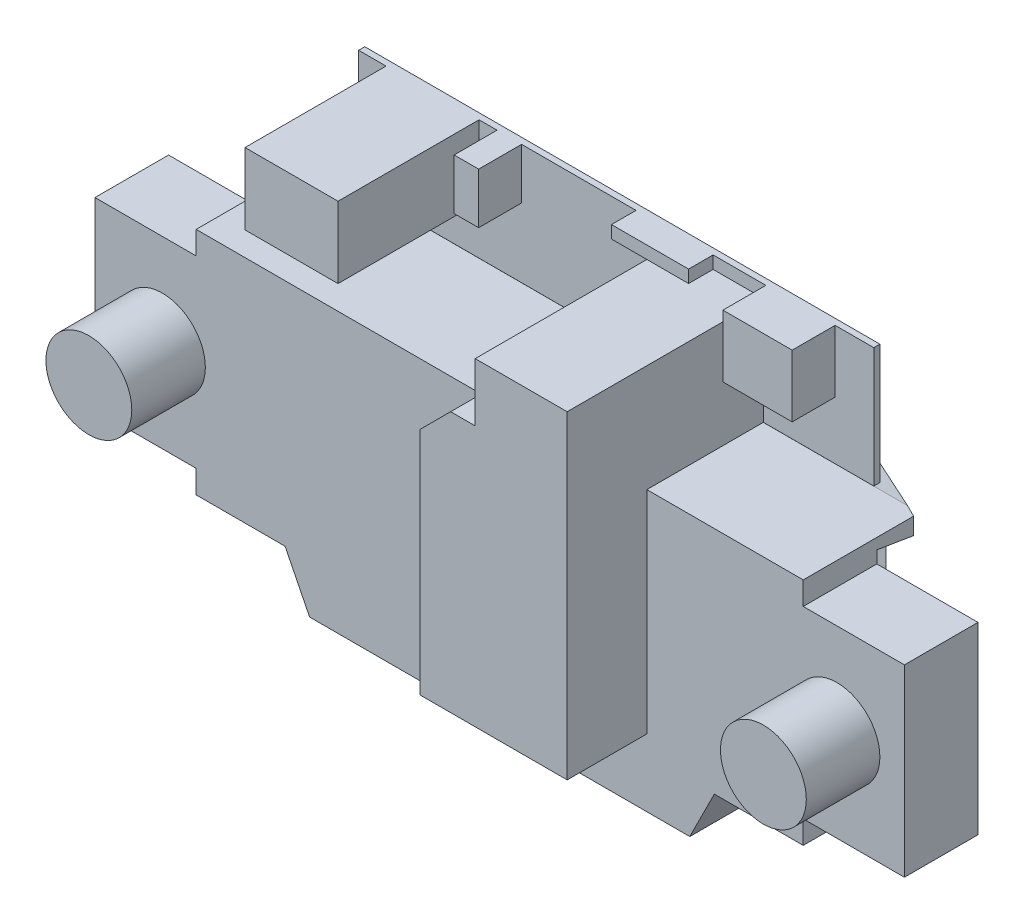
from build123d import *
from OCP.BRepFilletAPI import BRepFilletAPI_MakeChamfer

# Parameters (mm, degrees)
BOSS_EXTRUDE1_DEPTH = 25
SKETCH2_W           = 84
SKETCH2_H           = 19.546511152
BOSS_EXTRUDE2_DEPTH = 24
SKETCH3_W           = 12
SKETCH3_H           = 30
BOSS_EXTRUDE3_DEPTH = 16.5
SKETCH4_W           = 12
SKETCH4_H           = 30
BOSS_EXTRUDE4_DEPTH = 16.5
SKETCH5_W           = 24
SKETCH5_H           = 52
BOSS_EXTRUDE5_DEPTH = 13
SKETCH9_W           = 70
SKETCH9_H           = 10
BOSS_EXTRUDE6_DEPTH = 8
CHAMFER1_SIZE       = 8
CHAMFER1_SIZE_2     = 4
SKETCH10_R          = 7
BOSS_EXTRUDE7_DEPTH = 12
SKETCH11_R          = 1
CUT_EXTRUDE1_DEPTH  = 5
CUT_EXTRUDE24_DEPTH = 37.4999
CUT_EXTRUDE25_REACH = 90.714
CUT_EXTRUDE26_DEPTH = 99
CUT_EXTRUDE27_REACH = 129.479
CUT_EXTRUDE28_DEPTH = 69.00303493
CUT_EXTRUDE29_REACH = 129.479
SKETCH19_W          = 69.00303493
SKETCH19_H          = 6
CUT_EXTRUDE30_DEPTH = 3
CUT_EXTRUDE32_DEPTH = 23
SKETCH21_W          = 3.997604332
SKETCH21_H          = 8.279085248
SKETCH21_W_2        = 11.293242608
SKETCH21_H_2        = 10.138766403
CUT_EXTRUDE33_DEPTH = 16
SKETCH22_W          = 12.573143588
SKETCH22_H          = 2.046511152
CUT_EXTRUDE34_DEPTH = 19
CUT_EXTRUDE35_DEPTH = 32


with BuildPart() as part:
    # Sketch1 → Boss-Extrude1 (new body)
    with BuildSketch(Plane.XY):
        Polygon((49.5, 0), (49.5, 18.75), (-49.5, 18.75), (-49.5, -18.75), (49.5, -18.75), align=None)
    extrude(amount=BOSS_EXTRUDE1_DEPTH)

    # Sketch2 → Boss-Extrude2 (add)
    with BuildSketch(Plane(origin=(0, 0, 5), x_dir=(-1, 0, 0), z_dir=(0, 0, -1))):
        with Locations((0, 28.523255576)):
            Rectangle(SKETCH2_W, SKETCH2_H)
    extrude(amount=-BOSS_EXTRUDE2_DEPTH)

    # Sketch3 → Boss-Extrude3 (add)
    with BuildSketch(Plane(origin=(49.5, 0, 0), x_dir=(0, 0, -1), z_dir=(1, 0, 0))):
        with Locations((-19, 0)):
            Rectangle(SKETCH3_W, SKETCH3_H)
    extrude(amount=BOSS_EXTRUDE3_DEPTH)

    # Sketch4 → Boss-Extrude4 (add)
    with BuildSketch(Plane.ZY.offset(49.5)):
        with Locations((19, 0)):
            Rectangle(SKETCH4_W, SKETCH4_H)
    extrude(amount=BOSS_EXTRUDE4_DEPTH)

    # Sketch5 → Boss-Extrude5 (add)
    with BuildSketch(Plane.XY.offset(25)):
        with Locations((12, 10.25)):
            Rectangle(SKETCH5_W, SKETCH5_H)
    extrude(amount=BOSS_EXTRUDE5_DEPTH)

    # Sketch9 → Boss-Extrude6 (add)
    with BuildSketch(Plane.XZ.offset(18.75)):
        with Locations((0, 20)):
            Rectangle(SKETCH9_W, SKETCH9_H)
    extrude(amount=BOSS_EXTRUDE6_DEPTH)

    # Chamfer1
    chamfer1_edges_1 = [part.edges().sort_by_distance(p)[0] for p in [
        (-35, -26.75, 20),
    ]]
    chamfer1_side_1 = [part.faces().sort_by_distance(p)[0] for p in [
        (-35, -26.67, 20),
    ]]
    chamfer1_edges_2 = [part.edges().sort_by_distance(p)[0] for p in [
        (35, -26.75, 20),
    ]]
    chamfer1_side_2 = [part.faces().sort_by_distance(p)[0] for p in [
        (35, -26.67, 20),
    ]]
    chamfer1 = BRepFilletAPI_MakeChamfer(part.part.solid().wrapped)
    for e in chamfer1_edges_1:
        chamfer1.Add(CHAMFER1_SIZE - 0.0001, CHAMFER1_SIZE_2 - 0.0001, e.wrapped, chamfer1_side_1[0].wrapped)
    for e in chamfer1_edges_2:
        chamfer1.Add(CHAMFER1_SIZE - 0.0001, CHAMFER1_SIZE_2 - 0.0001, e.wrapped, chamfer1_side_2[0].wrapped)
    add(Compound.cast(chamfer1.Shape()), mode=Mode.REPLACE)  # a hair under: the kernel refuses the full size

    # Sketch10 → Boss-Extrude7 (add)
    with BuildSketch(Plane.XY.offset(25)):
        with Locations((-55, 0)):
            Circle(SKETCH10_R)
        with Locations((55, 0)):
            Circle(SKETCH10_R)
    extrude(amount=BOSS_EXTRUDE7_DEPTH)

    # Sketch11 → Cut-Extrude1 (cut)
    with BuildSketch(Plane(origin=(0, 0, 0), x_dir=(-1, 0, 0), z_dir=(0, 0, -1))):
        with Locations((-26, 7.5)):
            Circle(SKETCH11_R)
        with Locations((26, 7.5)):
            Circle(SKETCH11_R)
        with Locations((26, -7.5)):
            Circle(SKETCH11_R)
        with Locations((-26, -7.5)):
            Circle(SKETCH11_R)
    extrude(amount=-CUT_EXTRUDE1_DEPTH, mode=Mode.SUBTRACT)

    # Sketch12 → Cut-Extrude24 (cut)
    with BuildSketch(Plane.XZ.offset(18.75)):
        Polygon((49.5, 7), (35.5, 0), (49.5, 0), align=None)
        Polygon((-49.5, 0), (-49.5, 7), (-35.5, 0), align=None)
        Polygon((-42.50303493, 13.206106321), (-42.50303493, 9.79786642), (-32.90730209, 5), (32.904267164, 5), (42.5, 9.797866418), (42.5, 13), (34.5, 13), (34.5, 7), (-34.50303493, 7), (-34.50303493, 13.206106321), align=None)
    extrude(amount=-CUT_EXTRUDE24_DEPTH, mode=Mode.SUBTRACT)

    # Sketch13 → Cut-Extrude25 (cut, up to next)
    with BuildSketch(Plane.XZ.offset(-18.7499), mode=Mode.PRIVATE) as cut_extrude25_sk1:
        Polygon((49.5, 7), (49.5, 0), (35.5, 0), align=None)
    cut_extrude25_tool1 = extrude(cut_extrude25_sk1.sketch, amount=-CUT_EXTRUDE25_REACH, mode=Mode.PRIVATE) & part.part
    # Sketch13 → Cut-Extrude25 (cut, up to next)
    with BuildSketch(Plane.XZ.offset(-18.7499), mode=Mode.PRIVATE) as cut_extrude25_sk2:
        Polygon((-35.5, 0), (-49.5, 0), (-49.5, 7), align=None)
    cut_extrude25_tool2 = extrude(cut_extrude25_sk2.sketch, amount=-CUT_EXTRUDE25_REACH, mode=Mode.PRIVATE) & part.part
    add(cut_extrude25_tool1.solids().sort_by_distance((44.833333, 18.7499, 2.333333))[0], mode=Mode.SUBTRACT)
    add(cut_extrude25_tool2.solids().sort_by_distance((-44.833333, 18.7499, 2.333333))[0], mode=Mode.SUBTRACT)

    # Sketch14 → Cut-Extrude26 (cut)
    with BuildSketch(Plane.ZY.offset(49.5)):
        Polygon((13, 15.669938024), (7, 15.669938024), (7, -14.75), (2.533243234, -10.75), (2.533243234, 15.25), (13, 16.991870924), align=None)
        Polygon((0, 17.75), (0, 18.75), (6.008916401, 18.75), align=None)
        Polygon((0, -13.25), (6.141790553, -18.75), (0, -18.75), align=None)
    extrude(amount=-CUT_EXTRUDE26_DEPTH, mode=Mode.SUBTRACT)

    # Sketch15 → Cut-Extrude27 (cut, up to next)
    with BuildSketch(Plane.ZY.offset(49.5), mode=Mode.PRIVATE) as cut_extrude27_sk1:
        Polygon((7, -14.75), (13, -14.75), (13, 15), (13, 15.669938024), (7, 15.669938024), align=None)
    cut_extrude27_tool1 = extrude(cut_extrude27_sk1.sketch, amount=-CUT_EXTRUDE27_REACH, mode=Mode.PRIVATE) & part.part
    add(cut_extrude27_tool1.solids().sort_by_distance((-49.5, 0.459969, 10))[0], mode=Mode.SUBTRACT)

    # Sketch16 → Cut-Extrude28 (cut)
    with BuildSketch(Plane.ZY.offset(34.50303493)):
        Polygon((13, 15.669938024), (13.206106321, 15.669938024), (13.206106321, 18.7499), (7, 18.7499), (7, 15.993354786), (13, 16.991870924), align=None)
    extrude(amount=-CUT_EXTRUDE28_DEPTH, mode=Mode.SUBTRACT)

    # Sketch18 → Cut-Extrude29 (cut, up to next)
    with BuildSketch(Plane(origin=(49.5, 0, 0), x_dir=(0, 0, -1), z_dir=(1, 0, 0)), mode=Mode.PRIVATE) as cut_extrude29_sk1:
        Polygon((-13, 15.669938024), (-13, 15), (-13, -14.75), (-7, -14.75), (-7, 15.669938024), align=None)
    cut_extrude29_tool1 = extrude(cut_extrude29_sk1.sketch, amount=-CUT_EXTRUDE29_REACH, mode=Mode.PRIVATE) & part.part
    add(cut_extrude29_tool1.solids().sort_by_distance((49.5, 0.459969, 10))[0], mode=Mode.SUBTRACT)

    # Sketch19 → Cut-Extrude30 (cut)
    with BuildSketch(Plane.XZ.offset(18.75)):
        with Locations((-0.001517465, 10)):
            Rectangle(SKETCH19_W, SKETCH19_H)
    extrude(amount=-CUT_EXTRUDE30_DEPTH, mode=Mode.SUBTRACT)

    # Sketch20 → Cut-Extrude32 (cut)
    with BuildSketch(Plane.XY.offset(29)):
        Polygon((3.229837256, 36.25), (0, 36.25), (0, 18.75), (-42, 18.75), (-42, 38.296511152), (-37.533682083, 38.296511152), (-37.533682083, 26.659686261), (-22.363703257, 26.659686261), (-22.363703257, 38.296511152), (-19.429087816, 38.296511152), (-19.429087816, 30.017425904), (-15.431483484, 30.017425904), (-15.431483484, 38.296511152), (3.229837256, 38.296511152), align=None)
        Polygon((24.40253089, 38.296511152), (24.40253089, 28.157744749), (35.695773498, 28.157744749), (35.695773498, 38.296511152), (42, 38.296511152), (42, 18.75), (24, 18.75), (24, 36.25), (15.802980844, 36.25), (15.802980844, 38.296511152), align=None)
    extrude(amount=-CUT_EXTRUDE32_DEPTH, mode=Mode.SUBTRACT)

    # Sketch21 → Cut-Extrude33 (cut)
    with BuildSketch(Plane.XY.offset(29)):
        with Locations((-17.43028565, 34.156968528)):
            Rectangle(SKETCH21_W, SKETCH21_H)
        with Locations((30.049152194, 33.227127951)):
            Rectangle(SKETCH21_W_2, SKETCH21_H_2)
    extrude(amount=-CUT_EXTRUDE33_DEPTH, mode=Mode.SUBTRACT)

    # Sketch22 → Cut-Extrude34 (cut)
    with BuildSketch(Plane.XY.offset(29)):
        with Locations((9.51640905, 37.273255576)):
            Rectangle(SKETCH22_W, SKETCH22_H)
    extrude(amount=-CUT_EXTRUDE34_DEPTH, mode=Mode.SUBTRACT)

    # Sketch23 → Cut-Extrude35 (cut)
    with BuildSketch(Plane.XY.offset(38)):
        Polygon((0, 21.75), (5, 26.75), (9, 26.75), (9, 36.25), (0, 36.25), align=None)
    extrude(amount=-CUT_EXTRUDE35_DEPTH, mode=Mode.SUBTRACT)


solid = part.part
